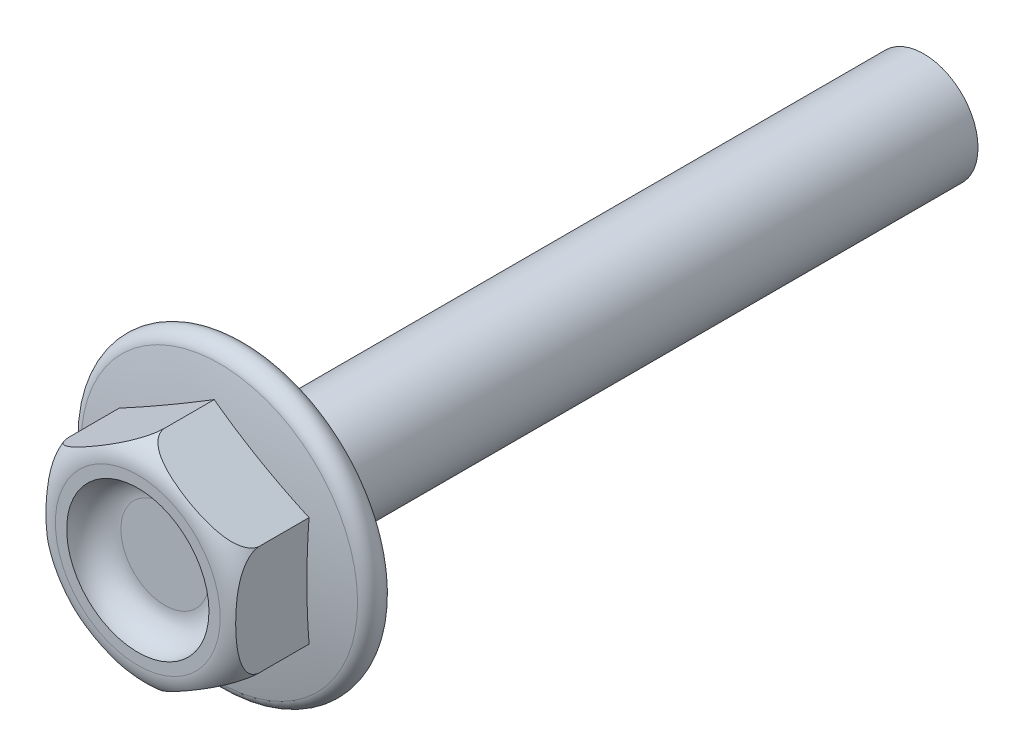
from build123d import *

# Parameters (mm, degrees)
HEAD_DEPTH     = 4
SHANK_SKETCH_R = 2
SHANK_DEPTH    = 25
SKETCH6_R      = 2.625
HEAD_CUT_DEPTH = 1
FILLET1_R      = 1


with BuildPart() as part:
    # Head Sketch → Head (new body)
    with BuildSketch(Plane.XY):
        Polygon((0, 4.041451884), (3.5, 2.020725942), (3.5, -2.020725942), (0, -4.041451884), (-3.5, -2.020725942), (-3.5, 2.020725942), align=None)
    extrude(amount=HEAD_DEPTH)

    # Shank Sketch → Shank (add)
    with BuildSketch(Plane.XY):
        Circle(SHANK_SKETCH_R)
    extrude(amount=-SHANK_DEPTH)

    # Sketch3 → Flange (revolve)
    with BuildSketch(Plane(origin=(0, 0, 0), x_dir=(-1, 0, 0), z_dir=(0, 1, 0)), mode=Mode.PRIVATE) as flange_sk:
        with BuildLine():
            Line((-5, 0), (0, 0))
            Line((0, 0), (0, 1.5))
            ThreePointArc((0, 1.5), (-2.562220765, 1.372207648), (-5.099009901, 0.99009901))
            ThreePointArc((-5.099009901, 0.99009901), (-5.497518595, 0.45024814), (-5, 0))
        make_face()
    revolve(flange_sk.sketch.rotate(Axis((0, 0, 0), (0, 0, 1)), 30), axis=Axis((0, 0, 0), (0, 0, 1)))

    # Sketch5 → Head Trim (revolve, cut)
    with BuildSketch(Plane(origin=(0, 0, 0), x_dir=(0, 0, -1), z_dir=(1, 0, 0)), mode=Mode.PRIVATE) as head_trim_sk:
        with BuildLine():
            Line((-4, -3.041451884), (-4, -4.041451884))
            Line((-4, -4.041451884), (-3, -4.041451884))
            ThreePointArc((-3, -4.041451884), (-3.707106781, -3.748558666), (-4, -3.041451884))
        make_face()
    revolve(head_trim_sk.sketch.rotate(Axis((0, 0, 15.085599173), (0, 0, -1)), 90), axis=Axis((0, 0, 15.085599173), (0, 0, -1)), mode=Mode.SUBTRACT)

    # Sketch6 → Head Cut (cut)
    with BuildSketch(Plane.XY.offset(4)):
        Circle(SKETCH6_R)
    extrude(amount=-HEAD_CUT_DEPTH, mode=Mode.SUBTRACT)

    # Fillet1
    fillet1_edges = [part.edges().sort_by_distance(p)[0] for p in [
        (-2.625, 0, 3),
    ]]
    fillet(fillet1_edges, radius=FILLET1_R - 0.0001)  # a hair under: the kernel refuses the full size


solid = part.part
